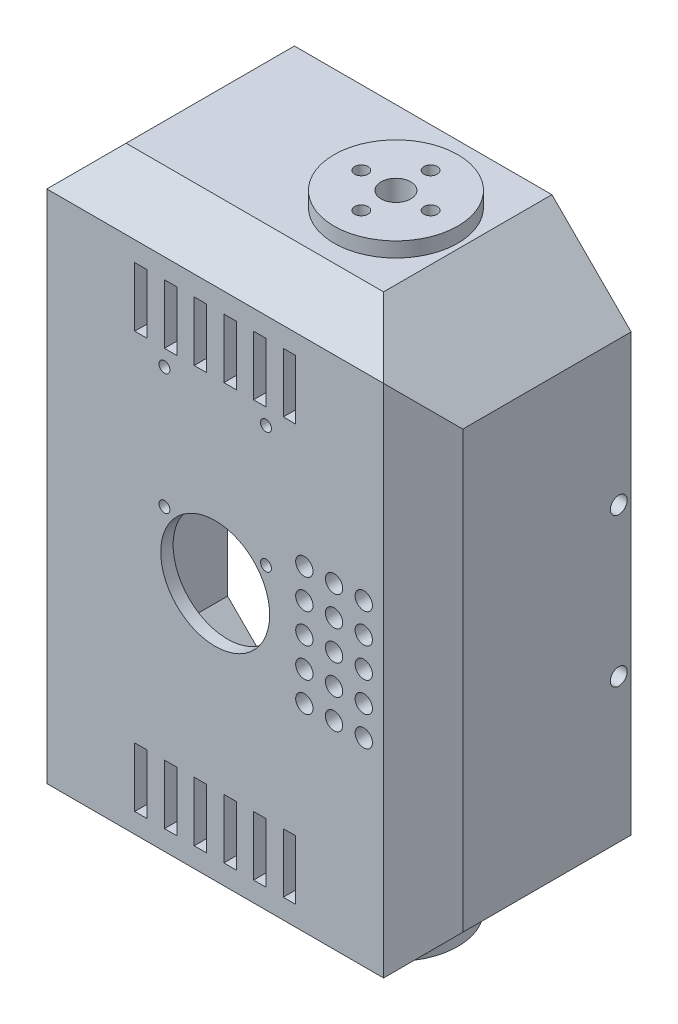
from build123d import *

# Parameters (mm, degrees)
BOSS_1_DEPTH    = 42
CUT_2_DEPTH     = 86
CUT_3_DEPTH     = 86
CUT_4_DEPTH     = 122
CUT_5_DEPTH     = 122
CUT_6_DEPTH     = 31.6
CUT_7_DEPTH     = 4.1
CUT_8_DEPTH     = 4.1
S_CUT9_W        = 2.5
S_CUT9_H        = 12
POCKET_9_DEPTH  = 2.7
S_CUT10_W       = 2.5
S_CUT10_H       = 12
POCKET_10_DEPTH = 2.7
S_CUT11_W       = 2.5
S_CUT11_H       = 12
POCKET_11_DEPTH = 2.7
S_CUT12_W       = 2.5
S_CUT12_H       = 12
POCKET_12_DEPTH = 2.7
S_CUT13_W       = 2.5
S_CUT13_H       = 12
POCKET_13_DEPTH = 2.7
S_CUT14_W       = 2.5
S_CUT14_H       = 12
POCKET_14_DEPTH = 2.7
S_HOLE15_R      = 1.7
HOLE_15_DEPTH   = 2.7
S_HOLE16_R      = 1.7
HOLE_16_DEPTH   = 2.7
S_CUT17_W       = 2.5
S_CUT17_H       = 12
POCKET_17_DEPTH = 2.7
S_CUT18_W       = 2.5
S_CUT18_H       = 12
POCKET_18_DEPTH = 2.7
S_CUT19_W       = 2.5
S_CUT19_H       = 12
POCKET_19_DEPTH = 2.7
S_CUT20_W       = 2.5
S_CUT20_H       = 12
POCKET_20_DEPTH = 2.7
S_CUT21_W       = 2.5
S_CUT21_H       = 12
POCKET_21_DEPTH = 2.7
S_CUT22_W       = 2.5
S_CUT22_H       = 12
POCKET_22_DEPTH = 2.7
S_HOLE23_R      = 1.7
HOLE_23_DEPTH   = 2.7
S_HOLE24_R      = 1.7
HOLE_24_DEPTH   = 2.7
S_HOLE25_R      = 1.75
HOLE_25_DEPTH   = 2.7
S_HOLE26_R      = 1.75
HOLE_26_DEPTH   = 2.7
S_HOLE27_R      = 1.75
HOLE_27_DEPTH   = 2.7
S_HOLE28_R      = 1.75
HOLE_28_DEPTH   = 2.7
S_HOLE29_R      = 1.75
HOLE_29_DEPTH   = 2.7
S_HOLE30_R      = 1.75
HOLE_30_DEPTH   = 2.7
S_HOLE31_R      = 1.75
HOLE_31_DEPTH   = 2.7
S_HOLE32_R      = 1.75
HOLE_32_DEPTH   = 2.7
S_HOLE33_R      = 1.75
HOLE_33_DEPTH   = 2.7
S_HOLE34_R      = 1.75
HOLE_34_DEPTH   = 2.7
S_HOLE35_R      = 1.75
HOLE_35_DEPTH   = 2.7
S_HOLE36_R      = 1.75
HOLE_36_DEPTH   = 2.7
S_HOLE37_R      = 1.75
HOLE_37_DEPTH   = 2.7
S_HOLE38_R      = 1.75
HOLE_38_DEPTH   = 2.7
S_HOLE39_R      = 1.75
HOLE_39_DEPTH   = 2.7
S_HOLE40_R      = 11
HOLE_40_DEPTH   = 2.7
S_HOLE41_R      = 1.1
HOLE_41_DEPTH   = 2.7
S_HOLE42_R      = 1.1
HOLE_42_DEPTH   = 2.7
S_HOLE43_R      = 1.1
HOLE_43_DEPTH   = 2.7
S_HOLE44_R      = 1.1
HOLE_44_DEPTH   = 2.7
S_CYL45_R       = 12.5
BOSS_45_DEPTH   = 6
S_CYL46_R       = 12.5
BOSS_46_DEPTH   = 6
S_HOLE47_R      = 3
HOLE_47_DEPTH   = 6.2
S_HOLE48_R      = 1.35
HOLE_48_DEPTH   = 6.2
S_HOLE49_R      = 1.35
HOLE_49_DEPTH   = 6.2
S_HOLE50_R      = 1.35
HOLE_50_DEPTH   = 6.2
S_HOLE51_R      = 1.35
HOLE_51_DEPTH   = 6.2
S_HOLE52_R      = 3
HOLE_52_DEPTH   = 6.2
S_HOLE53_R      = 1.35
HOLE_53_DEPTH   = 6.2
S_HOLE54_R      = 1.35
HOLE_54_DEPTH   = 6.2
S_HOLE55_R      = 1.35
HOLE_55_DEPTH   = 6.2
S_HOLE56_R      = 1.35
HOLE_56_DEPTH   = 6.2


with BuildPart() as part:
    # S_prism1 → Boss_1 (new body)
    with BuildSketch(Plane.XY.offset(168)):
        Polygon((42, -44), (42, 44), (26, 60), (-26, 60), (-42, 44), (-42, -44), (-26, -60), (26, -60), align=None)
    extrude(amount=BOSS_1_DEPTH)

    # S_pcut2 → Cut_2 (cut)
    with BuildSketch(Plane(origin=(-43, 0, 0), x_dir=(0, 0, -1), z_dir=(1, 0, 0))):
        Polygon((-210.6, 60.6), (-210.6, 51.4), (-201.4, 60.6), align=None)
    extrude(amount=CUT_2_DEPTH, mode=Mode.SUBTRACT)

    # S_pcut3 → Cut_3 (cut)
    with BuildSketch(Plane(origin=(-43, 0, 0), x_dir=(0, 0, -1), z_dir=(1, 0, 0))):
        Polygon((-210.6, -60.6), (-210.6, -51.4), (-201.4, -60.6), align=None)
    extrude(amount=CUT_3_DEPTH, mode=Mode.SUBTRACT)

    # S_pcut4 → Cut_4 (cut)
    with BuildSketch(Plane(origin=(0, -61, 0), x_dir=(1, 0, 0), z_dir=(0, 1, 0))):
        Polygon((42.6, -210.6), (33.4, -210.6), (42.6, -201.4), align=None)
    extrude(amount=CUT_4_DEPTH, mode=Mode.SUBTRACT)

    # S_pcut5 → Cut_5 (cut)
    with BuildSketch(Plane(origin=(0, -61, 0), x_dir=(1, 0, 0), z_dir=(0, 1, 0))):
        Polygon((-42.6, -210.6), (-33.4, -210.6), (-42.6, -201.4), align=None)
    extrude(amount=CUT_5_DEPTH, mode=Mode.SUBTRACT)

    # S_pcut6 → Cut_6 (cut)
    with BuildSketch(Plane.XY.offset(167.9)):
        Polygon((39.5, -42.964466094), (39.5, 42.964466094), (24.964466094, 57.5), (-24.964466094, 57.5), (-39.5, 42.964466094), (-39.5, -42.964466094), (-24.964466094, -57.5), (24.964466094, -57.5), align=None)
    extrude(amount=CUT_6_DEPTH, mode=Mode.SUBTRACT)

    # S_pcut7 → Cut_7 (cut)
    with BuildSketch(Plane.XY.offset(199.4)):
        Polygon((35.5, -41.307611845), (35.5, 41.307611845), (23.307611845, 53.5), (-23.307611845, 53.5), (-35.5, 41.307611845), (-35.5, -41.307611845), (-23.307611845, -53.5), (23.307611845, -53.5), align=None)
    extrude(amount=CUT_7_DEPTH, mode=Mode.SUBTRACT)

    # S_pcut8 → Cut_8 (cut)
    with BuildSketch(Plane.XY.offset(203.4)):
        Polygon((31.5, -39.650757595), (31.5, 39.650757595), (21.650757595, 49.5), (-21.650757595, 49.5), (-31.5, 39.650757595), (-31.5, -39.650757595), (-21.650757595, -49.5), (21.650757595, -49.5), align=None)
    extrude(amount=CUT_8_DEPTH, mode=Mode.SUBTRACT)

    # S_cut9 → Pocket_9 (cut)
    with BuildSketch(Plane.XY.offset(207.4)):
        with Locations((-15, 42)):
            Rectangle(S_CUT9_W, S_CUT9_H)
    extrude(amount=POCKET_9_DEPTH, mode=Mode.SUBTRACT)

    # S_cut10 → Pocket_10 (cut)
    with BuildSketch(Plane.XY.offset(207.4)):
        with Locations((-9, 42)):
            Rectangle(S_CUT10_W, S_CUT10_H)
    extrude(amount=POCKET_10_DEPTH, mode=Mode.SUBTRACT)

    # S_cut11 → Pocket_11 (cut)
    with BuildSketch(Plane.XY.offset(207.4)):
        with Locations((-3, 42)):
            Rectangle(S_CUT11_W, S_CUT11_H)
    extrude(amount=POCKET_11_DEPTH, mode=Mode.SUBTRACT)

    # S_cut12 → Pocket_12 (cut)
    with BuildSketch(Plane.XY.offset(207.4)):
        with Locations((3, 42)):
            Rectangle(S_CUT12_W, S_CUT12_H)
    extrude(amount=POCKET_12_DEPTH, mode=Mode.SUBTRACT)

    # S_cut13 → Pocket_13 (cut)
    with BuildSketch(Plane.XY.offset(207.4)):
        with Locations((9, 42)):
            Rectangle(S_CUT13_W, S_CUT13_H)
    extrude(amount=POCKET_13_DEPTH, mode=Mode.SUBTRACT)

    # S_cut14 → Pocket_14 (cut)
    with BuildSketch(Plane.XY.offset(207.4)):
        with Locations((15, 42)):
            Rectangle(S_CUT14_W, S_CUT14_H)
    extrude(amount=POCKET_14_DEPTH, mode=Mode.SUBTRACT)

    # S_hole15 → Hole_15 (cut)
    with BuildSketch(Plane(origin=(39.4, 0, 0), x_dir=(0, 0, -1), z_dir=(1, 0, 0))):
        with Locations((-170.5, -15)):
            Circle(S_HOLE15_R)
    extrude(amount=HOLE_15_DEPTH, mode=Mode.SUBTRACT)

    # S_hole16 → Hole_16 (cut)
    with BuildSketch(Plane(origin=(39.4, 0, 0), x_dir=(0, 0, -1), z_dir=(1, 0, 0))):
        with Locations((-170.5, 15)):
            Circle(S_HOLE16_R)
    extrude(amount=HOLE_16_DEPTH, mode=Mode.SUBTRACT)

    # S_cut17 → Pocket_17 (cut)
    with BuildSketch(Plane.XY.offset(207.4)):
        with Locations((-15, -42)):
            Rectangle(S_CUT17_W, S_CUT17_H)
    extrude(amount=POCKET_17_DEPTH, mode=Mode.SUBTRACT)

    # S_cut18 → Pocket_18 (cut)
    with BuildSketch(Plane.XY.offset(207.4)):
        with Locations((-9, -42)):
            Rectangle(S_CUT18_W, S_CUT18_H)
    extrude(amount=POCKET_18_DEPTH, mode=Mode.SUBTRACT)

    # S_cut19 → Pocket_19 (cut)
    with BuildSketch(Plane.XY.offset(207.4)):
        with Locations((-3, -42)):
            Rectangle(S_CUT19_W, S_CUT19_H)
    extrude(amount=POCKET_19_DEPTH, mode=Mode.SUBTRACT)

    # S_cut20 → Pocket_20 (cut)
    with BuildSketch(Plane.XY.offset(207.4)):
        with Locations((3, -42)):
            Rectangle(S_CUT20_W, S_CUT20_H)
    extrude(amount=POCKET_20_DEPTH, mode=Mode.SUBTRACT)

    # S_cut21 → Pocket_21 (cut)
    with BuildSketch(Plane.XY.offset(207.4)):
        with Locations((9, -42)):
            Rectangle(S_CUT21_W, S_CUT21_H)
    extrude(amount=POCKET_21_DEPTH, mode=Mode.SUBTRACT)

    # S_cut22 → Pocket_22 (cut)
    with BuildSketch(Plane.XY.offset(207.4)):
        with Locations((15, -42)):
            Rectangle(S_CUT22_W, S_CUT22_H)
    extrude(amount=POCKET_22_DEPTH, mode=Mode.SUBTRACT)

    # S_hole23 → Hole_23 (cut)
    with BuildSketch(Plane(origin=(-42.1, 0, 0), x_dir=(0, 0, -1), z_dir=(1, 0, 0))):
        with Locations((-170.5, -15)):
            Circle(S_HOLE23_R)
    extrude(amount=HOLE_23_DEPTH, mode=Mode.SUBTRACT)

    # S_hole24 → Hole_24 (cut)
    with BuildSketch(Plane(origin=(-42.1, 0, 0), x_dir=(0, 0, -1), z_dir=(1, 0, 0))):
        with Locations((-170.5, 15)):
            Circle(S_HOLE24_R)
    extrude(amount=HOLE_24_DEPTH, mode=Mode.SUBTRACT)

    # S_hole25 → Hole_25 (cut)
    with BuildSketch(Plane.XY.offset(207.4)):
        with Locations((18, -12)):
            Circle(S_HOLE25_R)
    extrude(amount=HOLE_25_DEPTH, mode=Mode.SUBTRACT)

    # S_hole26 → Hole_26 (cut)
    with BuildSketch(Plane.XY.offset(207.4)):
        with Locations((18, -6)):
            Circle(S_HOLE26_R)
    extrude(amount=HOLE_26_DEPTH, mode=Mode.SUBTRACT)

    # S_hole27 → Hole_27 (cut)
    with BuildSketch(Plane.XY.offset(207.4)):
        with Locations((18, 0)):
            Circle(S_HOLE27_R)
    extrude(amount=HOLE_27_DEPTH, mode=Mode.SUBTRACT)

    # S_hole28 → Hole_28 (cut)
    with BuildSketch(Plane.XY.offset(207.4)):
        with Locations((18, 6)):
            Circle(S_HOLE28_R)
    extrude(amount=HOLE_28_DEPTH, mode=Mode.SUBTRACT)

    # S_hole29 → Hole_29 (cut)
    with BuildSketch(Plane.XY.offset(207.4)):
        with Locations((18, 12)):
            Circle(S_HOLE29_R)
    extrude(amount=HOLE_29_DEPTH, mode=Mode.SUBTRACT)

    # S_hole30 → Hole_30 (cut)
    with BuildSketch(Plane.XY.offset(207.4)):
        with Locations((24, -12)):
            Circle(S_HOLE30_R)
    extrude(amount=HOLE_30_DEPTH, mode=Mode.SUBTRACT)

    # S_hole31 → Hole_31 (cut)
    with BuildSketch(Plane.XY.offset(207.4)):
        with Locations((24, -6)):
            Circle(S_HOLE31_R)
    extrude(amount=HOLE_31_DEPTH, mode=Mode.SUBTRACT)

    # S_hole32 → Hole_32 (cut)
    with BuildSketch(Plane.XY.offset(207.4)):
        with Locations((24, 0)):
            Circle(S_HOLE32_R)
    extrude(amount=HOLE_32_DEPTH, mode=Mode.SUBTRACT)

    # S_hole33 → Hole_33 (cut)
    with BuildSketch(Plane.XY.offset(207.4)):
        with Locations((24, 6)):
            Circle(S_HOLE33_R)
    extrude(amount=HOLE_33_DEPTH, mode=Mode.SUBTRACT)

    # S_hole34 → Hole_34 (cut)
    with BuildSketch(Plane.XY.offset(207.4)):
        with Locations((24, 12)):
            Circle(S_HOLE34_R)
    extrude(amount=HOLE_34_DEPTH, mode=Mode.SUBTRACT)

    # S_hole35 → Hole_35 (cut)
    with BuildSketch(Plane.XY.offset(207.4)):
        with Locations((30, -12)):
            Circle(S_HOLE35_R)
    extrude(amount=HOLE_35_DEPTH, mode=Mode.SUBTRACT)

    # S_hole36 → Hole_36 (cut)
    with BuildSketch(Plane.XY.offset(207.4)):
        with Locations((30, -6)):
            Circle(S_HOLE36_R)
    extrude(amount=HOLE_36_DEPTH, mode=Mode.SUBTRACT)

    # S_hole37 → Hole_37 (cut)
    with BuildSketch(Plane.XY.offset(207.4)):
        with Locations((30, 0)):
            Circle(S_HOLE37_R)
    extrude(amount=HOLE_37_DEPTH, mode=Mode.SUBTRACT)

    # S_hole38 → Hole_38 (cut)
    with BuildSketch(Plane.XY.offset(207.4)):
        with Locations((30, 6)):
            Circle(S_HOLE38_R)
    extrude(amount=HOLE_38_DEPTH, mode=Mode.SUBTRACT)

    # S_hole39 → Hole_39 (cut)
    with BuildSketch(Plane.XY.offset(207.4)):
        with Locations((30, 12)):
            Circle(S_HOLE39_R)
    extrude(amount=HOLE_39_DEPTH, mode=Mode.SUBTRACT)

    # S_hole40 → Hole_40 (cut)
    with BuildSketch(Plane.XY.offset(207.4)):
        Circle(S_HOLE40_R)
    extrude(amount=HOLE_40_DEPTH, mode=Mode.SUBTRACT)

    # S_hole41 → Hole_41 (cut)
    with BuildSketch(Plane.XY.offset(207.4)):
        with Locations((-10.25, 8.3)):
            Circle(S_HOLE41_R)
    extrude(amount=HOLE_41_DEPTH, mode=Mode.SUBTRACT)

    # S_hole42 → Hole_42 (cut)
    with BuildSketch(Plane.XY.offset(207.4)):
        with Locations((10.25, 8.3)):
            Circle(S_HOLE42_R)
    extrude(amount=HOLE_42_DEPTH, mode=Mode.SUBTRACT)

    # S_hole43 → Hole_43 (cut)
    with BuildSketch(Plane.XY.offset(207.4)):
        with Locations((-10.25, 32.75)):
            Circle(S_HOLE43_R)
    extrude(amount=HOLE_43_DEPTH, mode=Mode.SUBTRACT)

    # S_hole44 → Hole_44 (cut)
    with BuildSketch(Plane.XY.offset(207.4)):
        with Locations((10.25, 32.75)):
            Circle(S_HOLE44_R)
    extrude(amount=HOLE_44_DEPTH, mode=Mode.SUBTRACT)

    # S_cyl45 → Boss_45 (add)
    with BuildSketch(Plane(origin=(0, 57, 0), x_dir=(1, 0, 0), z_dir=(0, 1, 0))):
        with Locations((12.5, -186)):
            Circle(S_CYL45_R)
    extrude(amount=BOSS_45_DEPTH)

    # S_cyl46 → Boss_46 (add)
    with BuildSketch(Plane(origin=(0, -63, 0), x_dir=(1, 0, 0), z_dir=(0, 1, 0))):
        with Locations((12.5, -186)):
            Circle(S_CYL46_R)
    extrude(amount=BOSS_46_DEPTH)

    # S_hole47 → Hole_47 (cut)
    with BuildSketch(Plane(origin=(0, 56.9, 0), x_dir=(1, 0, 0), z_dir=(0, 1, 0))):
        with Locations((12.5, -186)):
            Circle(S_HOLE47_R)
    extrude(amount=HOLE_47_DEPTH, mode=Mode.SUBTRACT)

    # S_hole48 → Hole_48 (cut)
    with BuildSketch(Plane(origin=(0, 56.9, 0), x_dir=(1, 0, 0), z_dir=(0, 1, 0))):
        with Locations((19.5, -186)):
            Circle(S_HOLE48_R)
    extrude(amount=HOLE_48_DEPTH, mode=Mode.SUBTRACT)

    # S_hole49 → Hole_49 (cut)
    with BuildSketch(Plane(origin=(0, 56.9, 0), x_dir=(1, 0, 0), z_dir=(0, 1, 0))):
        with Locations((12.5, -193)):
            Circle(S_HOLE49_R)
    extrude(amount=HOLE_49_DEPTH, mode=Mode.SUBTRACT)

    # S_hole50 → Hole_50 (cut)
    with BuildSketch(Plane(origin=(0, 56.9, 0), x_dir=(1, 0, 0), z_dir=(0, 1, 0))):
        with Locations((5.5, -186)):
            Circle(S_HOLE50_R)
    extrude(amount=HOLE_50_DEPTH, mode=Mode.SUBTRACT)

    # S_hole51 → Hole_51 (cut)
    with BuildSketch(Plane(origin=(0, 56.9, 0), x_dir=(1, 0, 0), z_dir=(0, 1, 0))):
        with Locations((12.5, -179)):
            Circle(S_HOLE51_R)
    extrude(amount=HOLE_51_DEPTH, mode=Mode.SUBTRACT)

    # S_hole52 → Hole_52 (cut)
    with BuildSketch(Plane(origin=(0, -63.1, 0), x_dir=(1, 0, 0), z_dir=(0, 1, 0))):
        with Locations((12.5, -186)):
            Circle(S_HOLE52_R)
    extrude(amount=HOLE_52_DEPTH, mode=Mode.SUBTRACT)

    # S_hole53 → Hole_53 (cut)
    with BuildSketch(Plane(origin=(0, -63.1, 0), x_dir=(1, 0, 0), z_dir=(0, 1, 0))):
        with Locations((19.5, -186)):
            Circle(S_HOLE53_R)
    extrude(amount=HOLE_53_DEPTH, mode=Mode.SUBTRACT)

    # S_hole54 → Hole_54 (cut)
    with BuildSketch(Plane(origin=(0, -63.1, 0), x_dir=(1, 0, 0), z_dir=(0, 1, 0))):
        with Locations((12.5, -193)):
            Circle(S_HOLE54_R)
    extrude(amount=HOLE_54_DEPTH, mode=Mode.SUBTRACT)

    # S_hole55 → Hole_55 (cut)
    with BuildSketch(Plane(origin=(0, -63.1, 0), x_dir=(1, 0, 0), z_dir=(0, 1, 0))):
        with Locations((5.5, -186)):
            Circle(S_HOLE55_R)
    extrude(amount=HOLE_55_DEPTH, mode=Mode.SUBTRACT)

    # S_hole56 → Hole_56 (cut)
    with BuildSketch(Plane(origin=(0, -63.1, 0), x_dir=(1, 0, 0), z_dir=(0, 1, 0))):
        with Locations((12.5, -179)):
            Circle(S_HOLE56_R)
    extrude(amount=HOLE_56_DEPTH, mode=Mode.SUBTRACT)


solid = part.part
